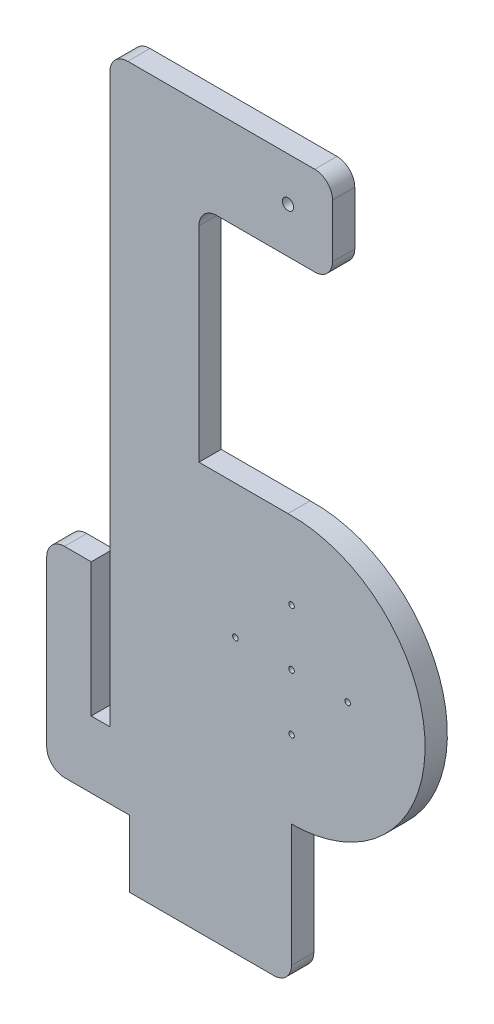
from build123d import *

# Parameters (mm, degrees)
SKETCH1_R           = 0.396875
SKETCH1_R_2         = 0.79375
BOSS_EXTRUDE1_DEPTH = 3.175
FILLET4_R           = 2.54


with BuildPart() as part:
    # Sketch1 → Boss-Extrude1 (new body)
    with BuildSketch(Plane.XY):
        with BuildLine():
            Line((-15.745072382, 12.323213632), (-9.395072382, 12.323213632))
            Line((-9.395072382, 12.323213632), (-9.395072382, -6.726786368))
            Line((-9.395072382, -6.726786368), (-6.728072382, -6.726786368))
            Line((-6.728072382, -6.726786368), (-6.728072382, 32.313013632))
            Line((-6.728072382, 32.313013632), (-6.728072382, 76.75623907))
            Line((-6.728072382, 76.75623907), (7.439652436, 76.75623907))
            Line((7.439652436, 76.75623907), (25.021927618, 76.75623907))
            Line((25.021927618, 76.75623907), (25.021927618, 64.05623907))
            Line((25.021927618, 64.05623907), (5.971927618, 64.05623907))
            Line((5.971927618, 64.05623907), (5.971927618, 32.30623907))
            Line((5.971927618, 32.30623907), (18.671926715, 32.30623907))
            ThreePointArc((18.671926715, 32.30623907), (38.228233902, 13.517036668), (19.179927618, -5.786986368))
            Line((19.179927618, -5.786986368), (19.179927618, -25.776786368))
            Line((19.179927618, -25.776786368), (-3.934072382, -25.776786368))
            Line((-3.934072382, -25.776786368), (-3.934072382, -16.251786368))
            Line((-3.934072382, -16.251786368), (-15.745072382, -16.251786368))
            Line((-15.745072382, -16.251786368), (-15.745072382, 12.323213632))
        make_face()
        with Locations((19.179927618, 21.263013632)):
            Circle(SKETCH1_R, mode=Mode.SUBTRACT)
        with Locations((19.179927618, 13.263013632)):
            Circle(SKETCH1_R, mode=Mode.SUBTRACT)
        with Locations((27.179927618, 13.263013632)):
            Circle(SKETCH1_R, mode=Mode.SUBTRACT)
        with Locations((19.179927618, 5.263013632)):
            Circle(SKETCH1_R, mode=Mode.SUBTRACT)
        with Locations((11.179927618, 13.263013632)):
            Circle(SKETCH1_R, mode=Mode.SUBTRACT)
        with Locations((18.671927618, 70.532315209)):
            Circle(SKETCH1_R_2, mode=Mode.SUBTRACT)
    extrude(amount=BOSS_EXTRUDE1_DEPTH)

    # Fillet4
    fillet4_edges = [part.edges().sort_by_distance(p)[0] for p in [
        (-15.745072382, -16.251786368, 1.5875),
        (-15.745072382, 12.323213632, 1.5875),
        (19.179927618, -25.776786368, 1.5875),
        (5.971927618, 64.05623907, 1.5875),
        (25.021927618, 64.05623907, 1.5875),
        (25.021927618, 76.75623907, 1.5875),
        (-6.728072382, 76.75623907, 1.5875),
    ]]
    fillet(fillet4_edges, radius=FILLET4_R)


solid = part.part
